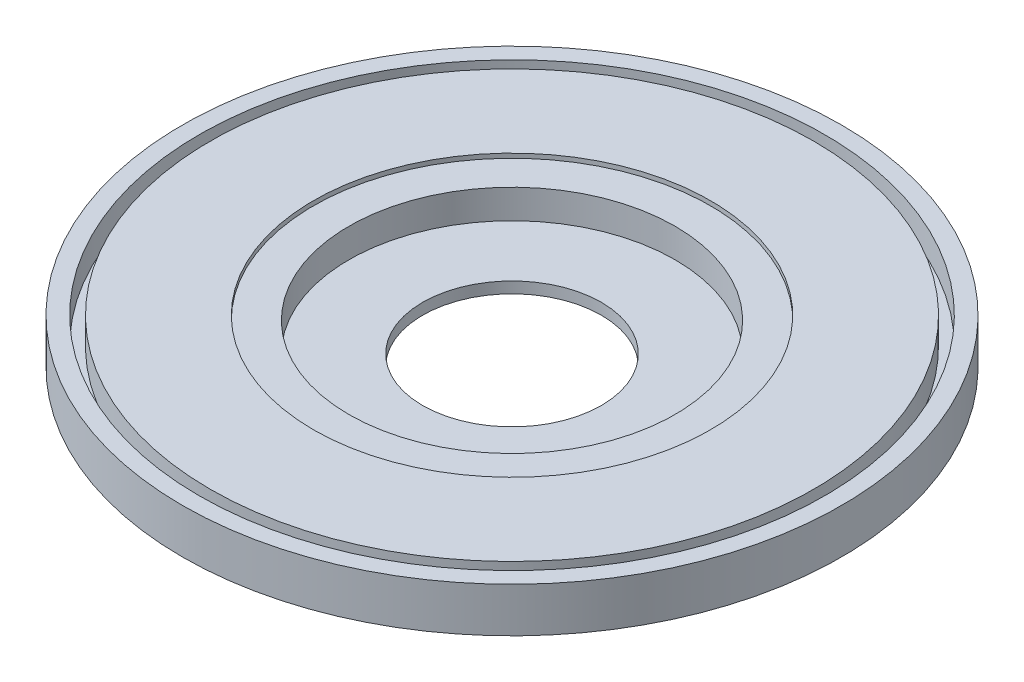
from build123d import *

# Parameters (mm, degrees)
SKETCH1_W           = 127.635
SKETCH1_H           = 127.635
BOSS_EXTRUDE1_DEPTH = 9.525
SKETCH13_R          = 93.6625
BOSS_EXTRUDE2_DEPTH = 12.7
SKETCH5_R           = 46.355
CUT_EXTRUDE1_DEPTH  = 9.525
SKETCH12_R          = 56.41975
CUT_EXTRUDE4_DEPTH  = 1.27
SKETCH16_R          = 88.9
SKETCH16_R_2        = 85.725
CUT_EXTRUDE5_DEPTH  = 7.62
SKETCH19_R          = 25.4
CUT_EXTRUDE7_DEPTH  = 87.63


with BuildPart() as part:
    # Sketch1 → Boss-Extrude1 (new body)
    with BuildSketch(Plane(origin=(0, 0, 0), x_dir=(1, 0, 0), z_dir=(0, 1, 0))):
        with Locations((63.8175, 63.8175)):
            Rectangle(SKETCH1_W, SKETCH1_H)
    extrude(amount=BOSS_EXTRUDE1_DEPTH)

    # Sketch13 → Boss-Extrude2 (add)
    with BuildSketch(Plane(origin=(0, 9.525, 0), x_dir=(1, 0, 0), z_dir=(0, 1, 0))):
        with Locations((63.8175, 63.8175)):
            Circle(SKETCH13_R)
    extrude(amount=-BOSS_EXTRUDE2_DEPTH)

    # Sketch5 → Cut-Extrude1 (cut)
    with BuildSketch(Plane(origin=(0, 9.525, 0), x_dir=(1, 0, 0), z_dir=(0, 1, 0))):
        with Locations((63.8175, 63.8175)):
            Circle(SKETCH5_R)
        with Locations((63.8175, 63.8175)):
            Circle(SKETCH5_R)
    extrude(amount=-CUT_EXTRUDE1_DEPTH, mode=Mode.SUBTRACT)

    # Sketch12 → Cut-Extrude4 (cut)
    with BuildSketch(Plane(origin=(0, 9.525, 0), x_dir=(1, 0, 0), z_dir=(0, 1, 0))):
        with Locations((63.8175, 63.8175)):
            Circle(SKETCH12_R)
    extrude(amount=-CUT_EXTRUDE4_DEPTH, mode=Mode.SUBTRACT)

    # Sketch16 → Cut-Extrude5 (cut)
    with BuildSketch(Plane(origin=(0, 9.525, 0), x_dir=(1, 0, 0), z_dir=(0, 1, 0))):
        with Locations((63.8175, 63.8175)):
            Circle(SKETCH16_R)
        with Locations((63.8175, 63.8175)):
            Circle(SKETCH16_R_2, mode=Mode.SUBTRACT)
    extrude(amount=-CUT_EXTRUDE5_DEPTH, mode=Mode.SUBTRACT)

    # Sketch19 → Cut-Extrude7 (cut)
    with BuildSketch(Plane.XZ.offset(3.175)):
        with Locations((63.8175, -63.8175)):
            Circle(SKETCH19_R)
    extrude(amount=-CUT_EXTRUDE7_DEPTH, mode=Mode.SUBTRACT)


solid = part.part
